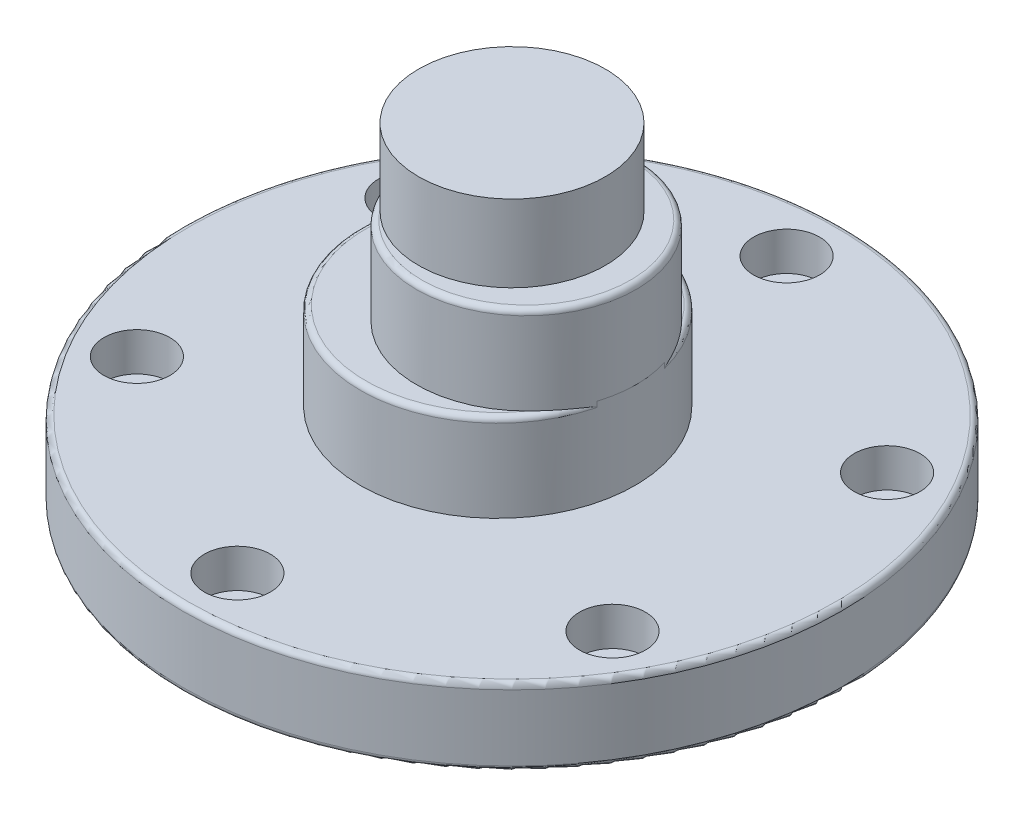
from build123d import *

# Parameters (mm, degrees)
SKETCH1_R           = 30
SKETCH1_R_2         = 1.65
BOSS_EXTRUDE1_DEPTH = 7
SKETCH2_R           = 12.5
BOSS_EXTRUDE2_DEPTH = 8
SKETCH3_R           = 10
BOSS_EXTRUDE3_DEPTH = 8
FILLET1_R           = 0.5
SKETCH4_R           = 3
CUT_EXTRUDE1_DEPTH  = 3.5
SKETCH5_R           = 8.5
BOSS_EXTRUDE4_DEPTH = 7


with BuildPart() as part:
    # Sketch1 → Boss-Extrude1 (new body)
    with BuildSketch(Plane(origin=(0, 0, 0), x_dir=(1, 0, 0), z_dir=(0, 1, 0))):
        Circle(SKETCH1_R)
        with Locations((0, 25)):
            Circle(SKETCH1_R_2, mode=Mode.SUBTRACT)
        with Locations((21.650635095, 12.5)):
            Circle(SKETCH1_R_2, mode=Mode.SUBTRACT)
        with Locations((21.650635095, -12.5)):
            Circle(SKETCH1_R_2, mode=Mode.SUBTRACT)
        with Locations((0, -25)):
            Circle(SKETCH1_R_2, mode=Mode.SUBTRACT)
        with Locations((-21.650635095, -12.5)):
            Circle(SKETCH1_R_2, mode=Mode.SUBTRACT)
        with Locations((-21.650635095, 12.5)):
            Circle(SKETCH1_R_2, mode=Mode.SUBTRACT)
    extrude(amount=BOSS_EXTRUDE1_DEPTH)

    # Sketch2 → Boss-Extrude2 (add)
    with BuildSketch(Plane(origin=(0, 7, 0), x_dir=(1, 0, 0), z_dir=(0, 1, 0))):
        with Locations((-1.3, 0)):
            Circle(SKETCH2_R)
    extrude(amount=BOSS_EXTRUDE2_DEPTH)

    # Sketch3 → Boss-Extrude3 (add)
    with BuildSketch(Plane(origin=(0, 15, 0), x_dir=(1, 0, 0), z_dir=(0, 1, 0))):
        with Locations((1.3, 0)):
            Circle(SKETCH3_R)
    extrude(amount=BOSS_EXTRUDE3_DEPTH)

    # Fillet1
    fillet1_edges = [part.edges().sort_by_distance(p)[0] for p in [
        (-8.7, 23, 0),
        (-13.8, 15, 0),
        (-30, 0, 0),
        (-30, 7, 0),
    ]]
    fillet(fillet1_edges, radius=FILLET1_R)

    # Sketch4 → Cut-Extrude1 (cut)
    with BuildSketch(Plane(origin=(0, 7, 0), x_dir=(1, 0, 0), z_dir=(0, 1, 0))):
        with Locations((0, 25)):
            Circle(SKETCH4_R)
        with Locations((21.650635095, 12.5)):
            Circle(SKETCH4_R)
        with Locations((21.650635095, -12.5)):
            Circle(SKETCH4_R)
        with Locations((0, -25)):
            Circle(SKETCH4_R)
        with Locations((-21.650635095, -12.5)):
            Circle(SKETCH4_R)
        with Locations((-21.650635095, 12.5)):
            Circle(SKETCH4_R)
    extrude(amount=-CUT_EXTRUDE1_DEPTH, mode=Mode.SUBTRACT)

    # Sketch5 → Boss-Extrude4 (add)
    with BuildSketch(Plane(origin=(0, 23, 0), x_dir=(1, 0, 0), z_dir=(0, 1, 0))):
        Circle(SKETCH5_R)
    extrude(amount=BOSS_EXTRUDE4_DEPTH)


solid = part.part
